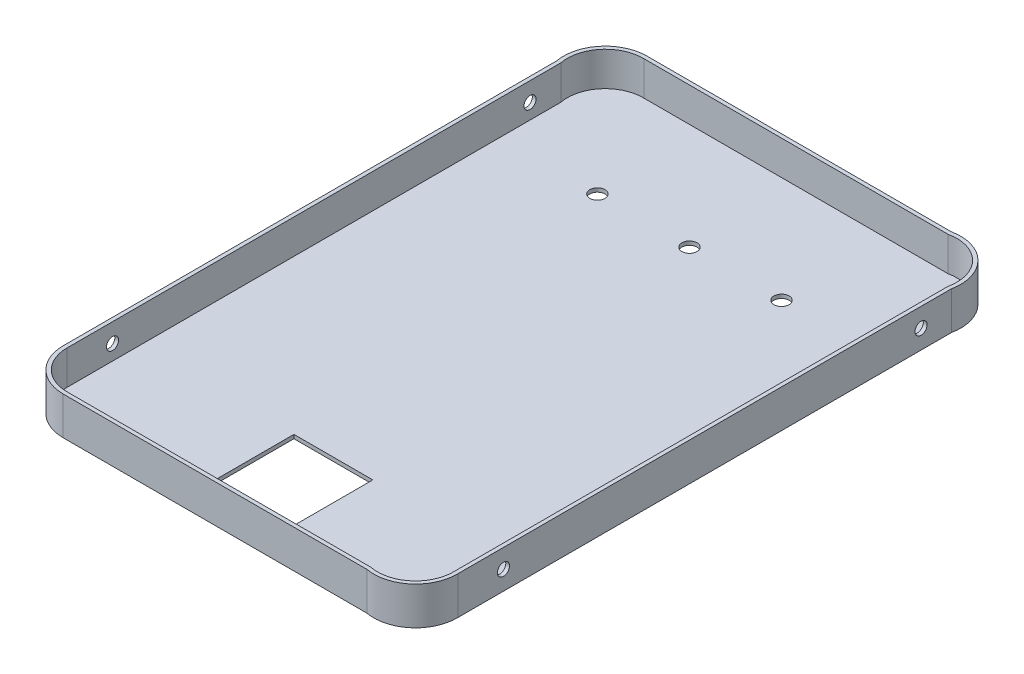
from build123d import *

# Parameters (mm, degrees)
EXTRUDE_1_DEPTH          = 10
SHELL_START              = 1
SHELL_5_DEPTH            = 9
CUT_EXTRUDE_1_DEPTH      = 134.004728562
CUT_EXTRUDE_1_DEPTH_BACK = 134.004728562
SKETCH_2_R               = 1.6
SKETCH_6_W               = 20.772573636
SKETCH_6_H               = 20.357122163
CUT_EXTRUDE_2_DEPTH      = 104.896631765
CUT_EXTRUDE_3_REACH      = 105.897
SKETCH_9_R               = 2


# Read off the part's stored shape, not the designer's step: 薄殼5
with BuildPart() as part:
    # 草圖1 → 填料-伸長1 (new body)
    with BuildSketch(Plane(origin=(0, 0, 0), x_dir=(1, 0, 0), z_dir=(0, 1, 0))):
        with BuildLine():
            Line((-41.238095238, 59.166666667), (-41.238095238, -70.833333333))
            ThreePointArc((-41.238095238, -70.833333333), (-38.016269831, -78.611507926), (-30.238095238, -81.833333333))
            Line((-30.238095238, -81.833333333), (49.761904762, -81.833333333))
            ThreePointArc((49.761904762, -81.833333333), (58.868802246, -79.414212178), (62.761904762, -70.833333333))
            Line((62.761904762, -70.833333333), (62.761904762, 59.166666667))
            ThreePointArc((62.761904762, 59.166666667), (59.768077482, 69.172839387), (49.761904762, 72.166666667))
            Line((49.761904762, 72.166666667), (-30.238095238, 72.166666667))
            ThreePointArc((-30.238095238, 72.166666667), (-38.818974083, 68.273564151), (-41.238095238, 59.166666667))
        make_face()
    extrude(amount=EXTRUDE_1_DEPTH)

    # 薄殼5 outline → 薄殼5 (cut)
    with BuildSketch(Plane(origin=(0, 0, 0), x_dir=(1, 0, 0), z_dir=(0, 1, 0)).offset(SHELL_START)):
        with BuildLine():
            ThreePointArc((-30.246641499, 71.166666667), (-38.08182369, 67.59648754), (-40.238095238, 59.260616141))
            Line((-40.238095238, 59.260616141), (-40.238095238, -70.833333333))
            ThreePointArc((-40.238095238, -70.833333333), (-37.30916305, -77.904401145), (-30.238095238, -80.833333333))
            Line((-30.238095238, -80.833333333), (49.855854237, -80.833333333))
            ThreePointArc((49.855854237, -80.833333333), (58.191725636, -78.677061785), (61.761904762, -70.841879594))
            Line((61.761904762, -70.841879594), (61.761904762, 59.271464521))
            ThreePointArc((61.761904762, 59.271464521), (59.060970701, 68.465732606), (49.866702616, 71.166666667))
            Line((49.866702616, 71.166666667), (-30.246641499, 71.166666667))
        make_face()
    extrude(amount=SHELL_5_DEPTH, mode=Mode.SUBTRACT)

    # 草圖2 → 除料-伸長1 (cut, two sides: drawn at the far end of the back side and taken through both)
    with BuildSketch(Plane.ZY.offset(41.238095238).offset(-CUT_EXTRUDE_1_DEPTH_BACK)):
        with Locations((-51.166666667, 5)):
            Circle(SKETCH_2_R)
        with Locations((58.833333333, 5)):
            Circle(SKETCH_2_R)
    extrude(amount=CUT_EXTRUDE_1_DEPTH + CUT_EXTRUDE_1_DEPTH_BACK, mode=Mode.SUBTRACT)

    # 草圖6 → 除料-伸長2 (cut, through all)
    with BuildSketch(Plane(origin=(0, 0, 0), x_dir=(-1, 0, 0), z_dir=(0, -1, 0))):
        with Locations((-10.761904762, -61.833333334)):
            Rectangle(SKETCH_6_W, SKETCH_6_H)
    extrude(amount=-CUT_EXTRUDE_2_DEPTH, mode=Mode.SUBTRACT)

    # 草圖9 → 除料-伸長3 (cut, up to next)
    with BuildSketch(Plane.XZ, mode=Mode.PRIVATE) as cut_extrude_3_sk1:
        with Locations(Location((-14.488095238, -43.164036493, 0), (0, 0, 270))):
            Circle(SKETCH_9_R)
    cut_extrude_3_tool1 = extrude(cut_extrude_3_sk1.sketch, amount=-CUT_EXTRUDE_3_REACH, mode=Mode.PRIVATE) & part.part
    # 草圖9 → 除料-伸長3 (cut, up to next)
    with BuildSketch(Plane.XZ, mode=Mode.PRIVATE) as cut_extrude_3_sk2:
        with Locations(Location((34.011904762, -43.164036493, 0), (0, 0, 90))):
            Circle(SKETCH_9_R)
    cut_extrude_3_tool2 = extrude(cut_extrude_3_sk2.sketch, amount=-CUT_EXTRUDE_3_REACH, mode=Mode.PRIVATE) & part.part
    # 草圖9 → 除料-伸長3 (cut, up to next)
    with BuildSketch(Plane.XZ, mode=Mode.PRIVATE) as cut_extrude_3_sk3:
        with Locations(Location((9.761904762, -43.164036493, 0), (0, 0, 270))):
            Circle(SKETCH_9_R)
    cut_extrude_3_tool3 = extrude(cut_extrude_3_sk3.sketch, amount=-CUT_EXTRUDE_3_REACH, mode=Mode.PRIVATE) & part.part
    add(cut_extrude_3_tool1.solids().sort_by_distance((-14.488095, 0, -43.164036))[0], mode=Mode.SUBTRACT)
    add(cut_extrude_3_tool2.solids().sort_by_distance((34.011905, 0, -43.164036))[0], mode=Mode.SUBTRACT)
    add(cut_extrude_3_tool3.solids().sort_by_distance((9.761905, 0, -43.164036))[0], mode=Mode.SUBTRACT)


solid = part.part
